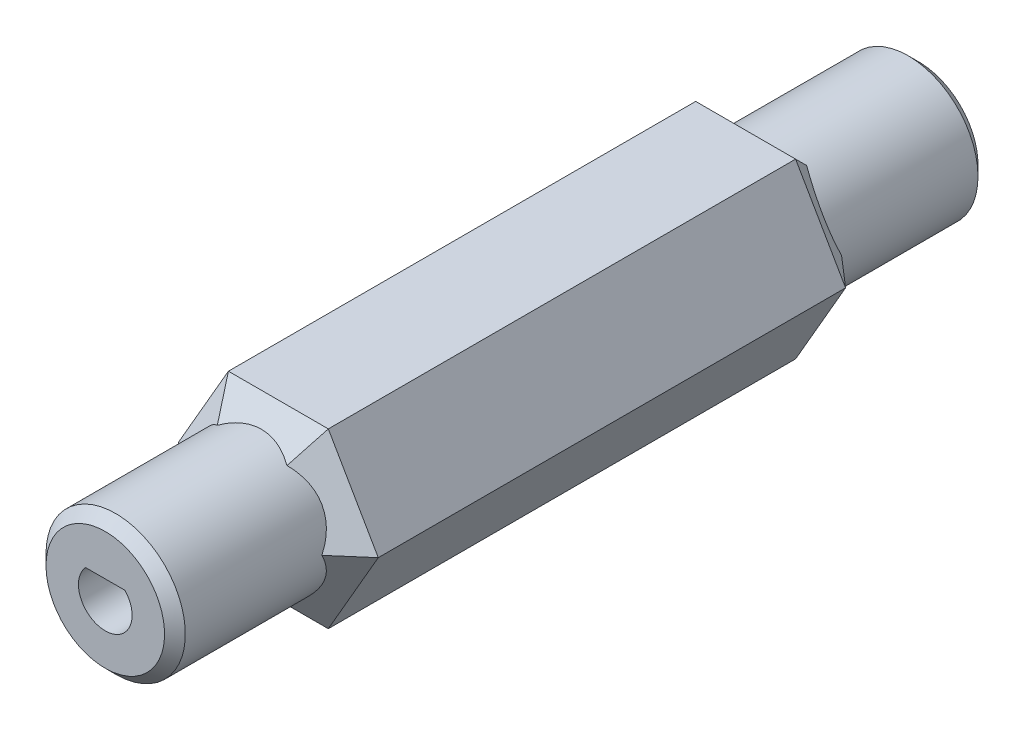
from build123d import *

# Parameters (mm, degrees)
EXTRUDE_1_DEPTH            = 30
SKETCH_2_R                 = 4.025
EXTRUDE_2_DEPTH            = 8.5
CHAMFER_1_SIZE             = 0.6
CUT_EXTRUDE_1_DEPTH        = 8
CHAMFER_1_OF_MIRROR_1_SIZE = 0.6
CHAMFER_2_SIZE             = 1.5


with BuildPart() as part:
    # 草图1 → 凸台-拉伸1 (new body)
    with BuildSketch(Plane.XY):
        Polygon((5.773502692, 0), (2.886751346, 5), (-2.886751346, 5), (-5.773502692, 0), (-2.886751346, -5), (2.886751346, -5), align=None)
    extrude(amount=EXTRUDE_1_DEPTH)

    # 草图2 → 凸台-拉伸2 (add)
    with BuildSketch(Plane.XY.offset(30)):
        Circle(SKETCH_2_R)
    extrude_2 = extrude(amount=EXTRUDE_2_DEPTH)

    # 倒角1
    chamfer_1_edges = [part.edges().sort_by_distance(p)[0] for p in [
        (-4.025, 0, 38.5),
    ]]
    chamfer(chamfer_1_edges, length=CHAMFER_1_SIZE)

    # 草图3 → 切除-拉伸1 (cut)
    with BuildSketch(Plane.XY.offset(38.5)):
        with BuildLine():
            Line((-1.140175425, 1.05), (1.140175425, 1.05))
            ThreePointArc((1.140175425, 1.05), (0, -1.55), (-1.140175425, 1.05))
        make_face()
    cut_extrude_1 = extrude(amount=-CUT_EXTRUDE_1_DEPTH, mode=Mode.SUBTRACT)

    # 镜向1: 凸台-拉伸2, 切除-拉伸1 across plane
    add(extrude_2.mirror(Plane.XY.offset(15)))
    add(cut_extrude_1.mirror(Plane.XY.offset(15)), mode=Mode.SUBTRACT)

    # 倒角1 of 镜向1
    chamfer_1_of_mirror_1_edges = [part.edges().sort_by_distance(p)[0] for p in [
        (-4.025, 0, -8.5),
    ]]
    chamfer(chamfer_1_of_mirror_1_edges, length=CHAMFER_1_OF_MIRROR_1_SIZE)

    # 倒角2
    # the kernel refuses this chamfer: 1.5 mm, written as the material it takes off along each edge
    with BuildSketch(Plane(origin=(6.744275828, 5, 30), x_dir=(0, 0.02749587661058619, -0.9996219169112968), z_dir=(-1, 0, 0))) as chamfer_2_piece_1_section:
        Polygon((CHAMFER_2_SIZE * 0.999621916911, CHAMFER_2_SIZE * 0.0274958766106), (-CHAMFER_2_SIZE * 0.0274958766106, CHAMFER_2_SIZE * 0.999621916911), (0, 0), align=None)
    chamfer_2_piece_1 = extrude(amount=13.488551656, mode=Mode.PRIVATE)
    chamfer_2_piece_1 = chamfer_2_piece_1 - Plane(origin=(0, 0, 29.496283427), x_dir=(1, 0, 0), z_dir=(0, 0, -1)) * Cylinder(4.025, 33, mode=Mode.PRIVATE)
    add(chamfer_2_piece_1, mode=Mode.SUBTRACT)
    with BuildSketch(Plane(origin=(-0.957989105, 8.340714197, 30), x_dir=(-0.02381212764409015, 0.013747938305292993, -0.9996219169112968), z_dir=(-0.49999999999999506, -0.8660254037844416, 0))) as chamfer_2_piece_2_section:
        Polygon((CHAMFER_2_SIZE * 0.999621916911, CHAMFER_2_SIZE * 0.0274958766106), (-CHAMFER_2_SIZE * 0.0274958766106, CHAMFER_2_SIZE * 0.999621916911), (0, 0), align=None)
    chamfer_2_piece_2 = extrude(amount=13.488551656, mode=Mode.PRIVATE)
    chamfer_2_piece_2 = chamfer_2_piece_2 - Plane(origin=(0, 0, 29.496283427), x_dir=(1, 0, 0), z_dir=(0, 0, -1)) * Cylinder(4.025, 33, mode=Mode.PRIVATE)
    add(chamfer_2_piece_2, mode=Mode.SUBTRACT)
    with BuildSketch(Plane(origin=(-7.702264933, 3.340714197, 30), x_dir=(-0.023812127644089943, -0.013747938305293316, -0.9996219169112968), z_dir=(0.5000000000000071, -0.8660254037844346, 0))) as chamfer_2_piece_3_section:
        Polygon((CHAMFER_2_SIZE * 0.999621916911, CHAMFER_2_SIZE * 0.0274958766106), (-CHAMFER_2_SIZE * 0.0274958766106, CHAMFER_2_SIZE * 0.999621916911), (0, 0), align=None)
    chamfer_2_piece_3 = extrude(amount=13.488551656, mode=Mode.PRIVATE)
    chamfer_2_piece_3 = chamfer_2_piece_3 - Plane(origin=(0, 0, 29.496283427), x_dir=(1, 0, 0), z_dir=(0, 0, -1)) * Cylinder(4.025, 33, mode=Mode.PRIVATE)
    add(chamfer_2_piece_3, mode=Mode.SUBTRACT)
    with BuildSketch(Plane(origin=(-6.744275828, -5, 30), x_dir=(0, -0.02749587661058619, -0.9996219169112968), z_dir=(1, 0, 0))) as chamfer_2_piece_4_section:
        Polygon((CHAMFER_2_SIZE * 0.999621916911, CHAMFER_2_SIZE * 0.0274958766106), (-CHAMFER_2_SIZE * 0.0274958766106, CHAMFER_2_SIZE * 0.999621916911), (0, 0), align=None)
    chamfer_2_piece_4 = extrude(amount=13.488551656, mode=Mode.PRIVATE)
    chamfer_2_piece_4 = chamfer_2_piece_4 - Plane(origin=(0, 0, 29.496283427), x_dir=(1, 0, 0), z_dir=(0, 0, -1)) * Cylinder(4.025, 33, mode=Mode.PRIVATE)
    add(chamfer_2_piece_4, mode=Mode.SUBTRACT)
    with BuildSketch(Plane(origin=(0.957989105, -8.340714197, 30), x_dir=(0.02381212764409026, -0.013747938305293058, -0.9996219169112968), z_dir=(0.49999999999999506, 0.8660254037844416, 0))) as chamfer_2_piece_5_section:
        Polygon((CHAMFER_2_SIZE * 0.999621916911, CHAMFER_2_SIZE * 0.0274958766106), (-CHAMFER_2_SIZE * 0.0274958766106, CHAMFER_2_SIZE * 0.999621916911), (0, 0), align=None)
    chamfer_2_piece_5 = extrude(amount=13.488551656, mode=Mode.PRIVATE)
    chamfer_2_piece_5 = chamfer_2_piece_5 - Plane(origin=(0, 0, 29.496283427), x_dir=(1, 0, 0), z_dir=(0, 0, -1)) * Cylinder(4.025, 33, mode=Mode.PRIVATE)
    add(chamfer_2_piece_5, mode=Mode.SUBTRACT)
    with BuildSketch(Plane(origin=(-6.744275828, -5, 0), x_dir=(-1.0610740769848241e-14, 0.9996219169112969, -0.027495876610586372), z_dir=(1, 0, 0))) as chamfer_2_piece_6_section:
        Polygon((CHAMFER_2_SIZE * 0.999621916911, CHAMFER_2_SIZE * 0.0274958766106), (-CHAMFER_2_SIZE * 0.0274958766106, CHAMFER_2_SIZE * 0.999621916911), (0, 0), align=None)
    chamfer_2_piece_6 = extrude(amount=13.488551656, mode=Mode.PRIVATE)
    chamfer_2_piece_6 = chamfer_2_piece_6 - Plane(origin=(0, 0, 0.503716575), x_dir=(1, 0, 0), z_dir=(0, 0, 1)) * Cylinder(4.025, 33, mode=Mode.PRIVATE)
    add(chamfer_2_piece_6, mode=Mode.SUBTRACT)
    with BuildSketch(Plane(origin=(-7.702264933, 3.340714197, 0), x_dir=(0.8656979742248763, 0.49981095845565543, -0.027495876610586372), z_dir=(0.5000000000000071, -0.8660254037844346, 0))) as chamfer_2_piece_7_section:
        Polygon((CHAMFER_2_SIZE * 0.999621916911, CHAMFER_2_SIZE * 0.0274958766106), (-CHAMFER_2_SIZE * 0.0274958766106, CHAMFER_2_SIZE * 0.999621916911), (0, 0), align=None)
    chamfer_2_piece_7 = extrude(amount=13.488551656, mode=Mode.PRIVATE)
    chamfer_2_piece_7 = chamfer_2_piece_7 - Plane(origin=(0, 0, 0.503716575), x_dir=(1, 0, 0), z_dir=(0, 0, 1)) * Cylinder(4.025, 33, mode=Mode.PRIVATE)
    add(chamfer_2_piece_7, mode=Mode.SUBTRACT)
    with BuildSketch(Plane(origin=(-0.957989105, 8.340714197, 0), x_dir=(0.8656979742248831, -0.4998109584556434, -0.027495876610586365), z_dir=(-0.49999999999999506, -0.8660254037844416, 0))) as chamfer_2_piece_8_section:
        Polygon((CHAMFER_2_SIZE * 0.999621916911, CHAMFER_2_SIZE * 0.0274958766106), (-CHAMFER_2_SIZE * 0.0274958766106, CHAMFER_2_SIZE * 0.999621916911), (0, 0), align=None)
    chamfer_2_piece_8 = extrude(amount=13.488551656, mode=Mode.PRIVATE)
    chamfer_2_piece_8 = chamfer_2_piece_8 - Plane(origin=(0, 0, 0.503716575), x_dir=(1, 0, 0), z_dir=(0, 0, 1)) * Cylinder(4.025, 33, mode=Mode.PRIVATE)
    add(chamfer_2_piece_8, mode=Mode.SUBTRACT)
    with BuildSketch(Plane(origin=(6.744275828, 5, 0), x_dir=(3.2293558864755513e-15, -0.9996219169112969, -0.027495876610586372), z_dir=(-1, 0, 0))) as chamfer_2_piece_9_section:
        Polygon((CHAMFER_2_SIZE * 0.999621916911, CHAMFER_2_SIZE * 0.0274958766106), (-CHAMFER_2_SIZE * 0.0274958766106, CHAMFER_2_SIZE * 0.999621916911), (0, 0), align=None)
    chamfer_2_piece_9 = extrude(amount=13.488551656, mode=Mode.PRIVATE)
    chamfer_2_piece_9 = chamfer_2_piece_9 - Plane(origin=(0, 0, 0.503716575), x_dir=(1, 0, 0), z_dir=(0, 0, 1)) * Cylinder(4.025, 33, mode=Mode.PRIVATE)
    add(chamfer_2_piece_9, mode=Mode.SUBTRACT)
    with BuildSketch(Plane(origin=(7.702264933, -3.340714197, 0), x_dir=(-0.8656979742248797, -0.49981095845564943, -0.027495876610586372), z_dir=(-0.5000000000000011, 0.866025403784438, 0))) as chamfer_2_piece_10_section:
        Polygon((CHAMFER_2_SIZE * 0.999621916911, CHAMFER_2_SIZE * 0.0274958766106), (-CHAMFER_2_SIZE * 0.0274958766106, CHAMFER_2_SIZE * 0.999621916911), (0, 0), align=None)
    chamfer_2_piece_10 = extrude(amount=13.488551656, mode=Mode.PRIVATE)
    chamfer_2_piece_10 = chamfer_2_piece_10 - Plane(origin=(0, 0, 0.503716574), x_dir=(1, 0, 0), z_dir=(0, 0, 1)) * Cylinder(4.025, 33, mode=Mode.PRIVATE)
    add(chamfer_2_piece_10, mode=Mode.SUBTRACT)
    with BuildSketch(Plane(origin=(0.957989105, -8.340714197, 0), x_dir=(-0.8656979742248831, 0.4998109584556434, -0.02749587661058637), z_dir=(0.49999999999999506, 0.8660254037844416, 0))) as chamfer_2_piece_11_section:
        Polygon((CHAMFER_2_SIZE * 0.999621916911, CHAMFER_2_SIZE * 0.0274958766106), (-CHAMFER_2_SIZE * 0.0274958766106, CHAMFER_2_SIZE * 0.999621916911), (0, 0), align=None)
    chamfer_2_piece_11 = extrude(amount=13.488551656, mode=Mode.PRIVATE)
    chamfer_2_piece_11 = chamfer_2_piece_11 - Plane(origin=(0, 0, 0.503716575), x_dir=(1, 0, 0), z_dir=(0, 0, 1)) * Cylinder(4.025, 33, mode=Mode.PRIVATE)
    add(chamfer_2_piece_11, mode=Mode.SUBTRACT)
    with BuildSketch(Plane(origin=(7.702264933, -3.340714197, 30), x_dir=(0.02381212764409016, 0.013747938305293224, -0.9996219169112968), z_dir=(-0.5000000000000011, 0.866025403784438, 0))) as chamfer_2_piece_12_section:
        Polygon((CHAMFER_2_SIZE * 0.999621916911, CHAMFER_2_SIZE * 0.0274958766106), (-CHAMFER_2_SIZE * 0.0274958766106, CHAMFER_2_SIZE * 0.999621916911), (0, 0), align=None)
    chamfer_2_piece_12 = extrude(amount=13.488551656, mode=Mode.PRIVATE)
    chamfer_2_piece_12 = chamfer_2_piece_12 - Plane(origin=(0, 0, 29.496283426), x_dir=(1, 0, 0), z_dir=(0, 0, -1)) * Cylinder(4.025, 33, mode=Mode.PRIVATE)
    add(chamfer_2_piece_12, mode=Mode.SUBTRACT)


solid = part.part
